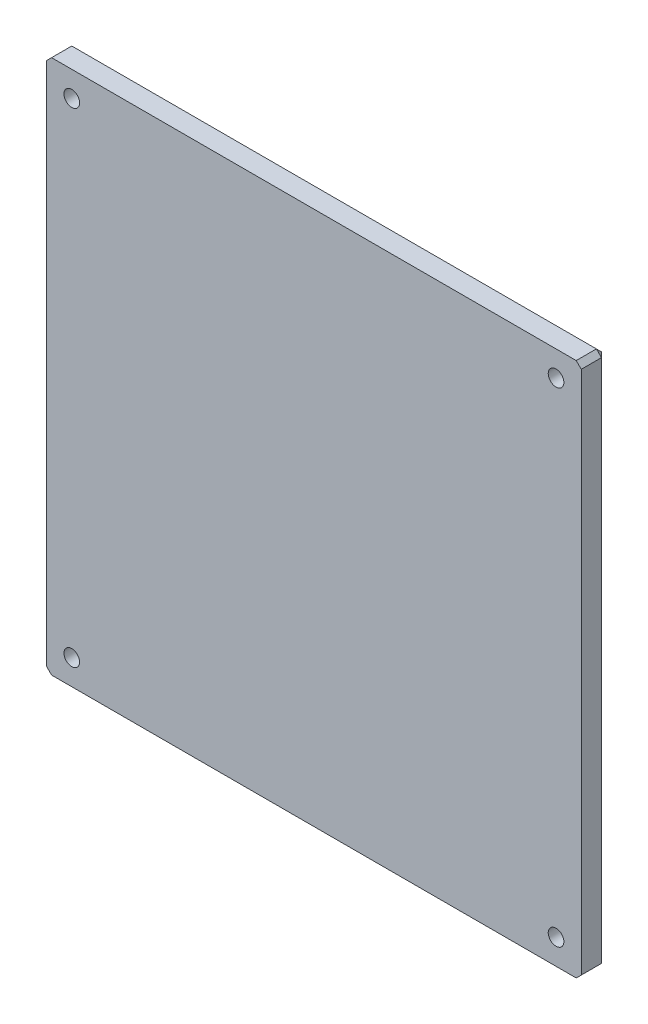
from build123d import *

# Parameters (mm, degrees)
SKETCH1_W           = 106
SKETCH1_H           = 106
BOSS_EXTRUDE1_DEPTH = 5
SKETCH2_R           = 1.55
CUT_EXTRUDE1_DEPTH  = 10
CHAMFER2_SIZE       = 2
CHAMFER3_SIZE       = 2
CHAMFER4_SIZE       = 1


with BuildPart() as part:
    # Sketch1 → Boss-Extrude1 (new body)
    with BuildSketch(Plane.XY):
        Rectangle(SKETCH1_W, SKETCH1_H)
    extrude(amount=BOSS_EXTRUDE1_DEPTH)

    # Sketch2 → Cut-Extrude1 (cut)
    with BuildSketch(Plane.XY):
        with Locations((-48, 48)):
            Circle(SKETCH2_R)
        with Locations((48, 48)):
            Circle(SKETCH2_R)
        with Locations((-48, -48)):
            Circle(SKETCH2_R)
        with Locations((48, -48)):
            Circle(SKETCH2_R)
    extrude(amount=CUT_EXTRUDE1_DEPTH, mode=Mode.SUBTRACT)

    # Chamfer2
    chamfer2_edges = [part.edges().sort_by_distance(p)[0] for p in [
        (46.45, 48, 0),
    ]]
    chamfer(chamfer2_edges, length=CHAMFER2_SIZE)

    # Chamfer3
    chamfer3_edges = [part.edges().sort_by_distance(p)[0] for p in [
        (-49.55, 48, 0),
        (-49.55, -48, 0),
        (46.45, -48, 0),
    ]]
    chamfer(chamfer3_edges, length=CHAMFER3_SIZE)

    # Chamfer4
    chamfer4_edges = [part.edges().sort_by_distance(p)[0] for p in [
        (53, -53, 2.5),
        (0, -53, 0),
        (-53, -53, 2.5),
        (-53, 0, 0),
        (-53, 53, 2.5),
        (0, 53, 0),
        (53, 0, 0),
        (53, 53, 2.5),
    ]]
    chamfer(chamfer4_edges, length=CHAMFER4_SIZE)


solid = part.part
